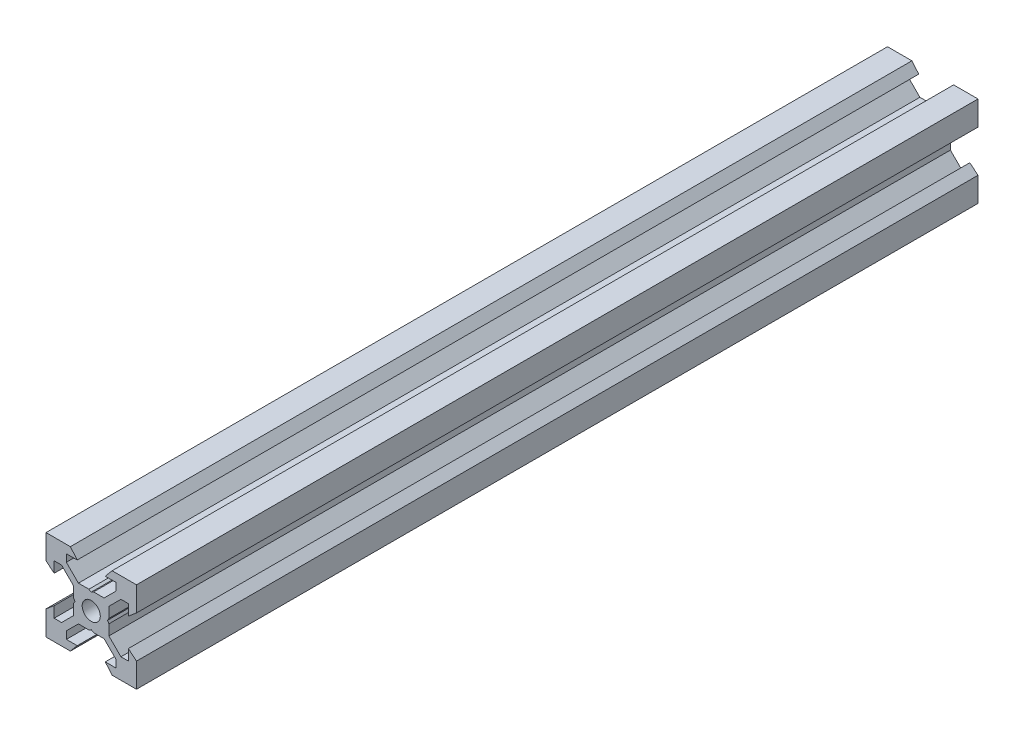
from build123d import *

# Parameters (mm, degrees)
SKETCH1_R           = 2
BOSS_EXTRUDE1_DEPTH = 93


with BuildPart() as part:
    # Sketch1 → Boss-Extrude1 (new, symmetric)
    with BuildSketch(Plane.XY):
        Polygon((10, 4.610379336), (10, 10), (4.610379336, 10), (3.1, 8.2), (5.5, 8.2), (5.5, 6.560660172), (2.839339828, 3.9), (0.519615242, 3.9), (0, 3.6), (-0.519615242, 3.9), (-2.839339828, 3.9), (-5.5, 6.560660172), (-5.5, 8.2), (-3.1, 8.2), (-4.610379336, 10), (-10, 10), (-10, 4.610379336), (-8.2, 3.1), (-8.2, 5.5), (-6.560660172, 5.5), (-3.9, 2.839339828), (-3.9, 0.519615242), (-3.6, 0), (-3.9, -0.519615242), (-3.9, -2.839339828), (-6.560660172, -5.5), (-8.2, -5.5), (-8.2, -3.1), (-10, -4.610379336), (-10, -10), (-4.610379336, -10), (-3.1, -8.2), (-5.5, -8.2), (-5.5, -6.560660172), (-2.839339828, -3.9), (-0.519615242, -3.9), (0, -3.6), (0.519615242, -3.9), (2.839339828, -3.9), (5.5, -6.560660172), (5.5, -8.2), (3.1, -8.2), (4.610379336, -10), (10, -10), (10, -4.610379336), (8.2, -3.1), (8.2, -5.5), (6.560660172, -5.5), (3.9, -2.839339828), (3.9, -0.519615242), (3.6, 0), (3.9, 0.519615242), (3.9, 2.839339828), (6.560660172, 5.5), (8.2, 5.5), (8.2, 3.1), align=None)
        Circle(SKETCH1_R, mode=Mode.SUBTRACT)
    extrude(amount=BOSS_EXTRUDE1_DEPTH, both=True)


solid = part.part
